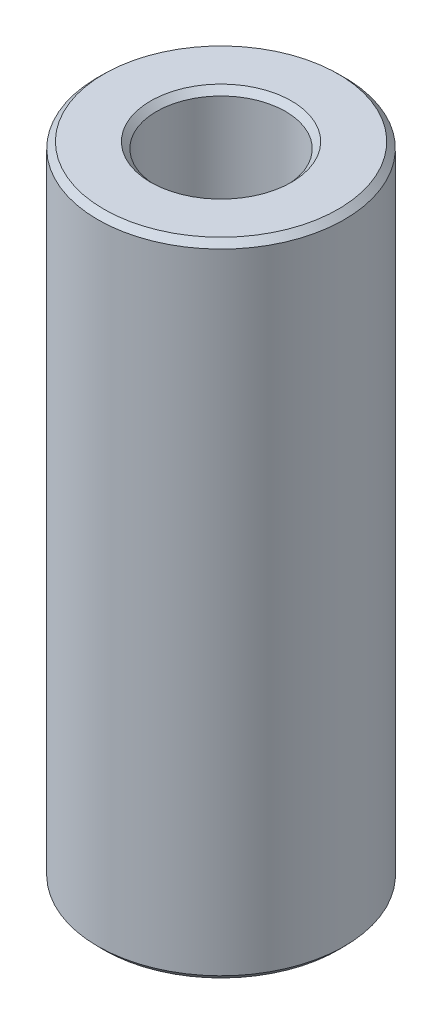
from build123d import *
from OCP.BRepFilletAPI import BRepFilletAPI_MakeChamfer

# Parameters (mm, degrees)
SKETCH1_R           = 10
BOSS_EXTRUDE1_DEPTH = 52.029353738
SKETCH2_R           = 5.234280895
CUT_EXTRUDE1_DEPTH  = 54.917099796
CHAMFER1_SIZE       = 0.483309275
CHAMFER1_SIZE2      = 0.496036834


with BuildPart() as part:
    # Sketch1 → Boss-Extrude1 (new body)
    with BuildSketch(Plane(origin=(0, 0, 0), x_dir=(1, 0, 0), z_dir=(0, 1, 0))):
        Circle(SKETCH1_R)
    extrude(amount=BOSS_EXTRUDE1_DEPTH)

    # Sketch2 → Cut-Extrude1 (cut, through all)
    with BuildSketch(Plane(origin=(0, 0, 0), x_dir=(1, 0, 0), z_dir=(0, 1, 0))):
        Circle(SKETCH2_R)
    extrude(amount=CUT_EXTRUDE1_DEPTH, mode=Mode.SUBTRACT)

    # Chamfer1: one chamfer whose edges measure the first distance from different faces: ONE call of the kernel's chamfer builder (chamfer() names one face for all edges)
    chamfer1_edges_1 = [part.edges().sort_by_distance(p)[0] for p in [
        (-5.234280895, 52.029353738, 0),
    ]]
    chamfer1_side_1 = [part.faces().sort_by_distance(p)[0] for p in [
        (-9.717157288, 52.029353738, 0),
    ]]
    chamfer1_edges_2 = [part.edges().sort_by_distance(p)[0] for p in [
        (-5.234280895, 0, 0),
    ]]
    chamfer1_side_2 = [part.faces().sort_by_distance(p)[0] for p in [
        (-5.234280895, 26.014676869, 0),
    ]]
    chamfer1_edges_3 = [part.edges().sort_by_distance(p)[0] for p in [
        (-10, 0, 0),
    ]]
    chamfer1_side_3 = [part.faces().sort_by_distance(p)[0] for p in [
        (-9.717157288, 0, 0),
    ]]
    chamfer1_edges_4 = [part.edges().sort_by_distance(p)[0] for p in [
        (-10, 52.029353738, 0),
    ]]
    chamfer1_side_4 = [part.faces().sort_by_distance(p)[0] for p in [
        (-10, 26.014676869, 0),
    ]]
    chamfer1 = BRepFilletAPI_MakeChamfer(part.part.solid().wrapped)
    for e in chamfer1_edges_1:
        chamfer1.Add(CHAMFER1_SIZE, CHAMFER1_SIZE2, e.wrapped, chamfer1_side_1[0].wrapped)  # the first distance lies on this face
    for e in chamfer1_edges_2:
        chamfer1.Add(CHAMFER1_SIZE, CHAMFER1_SIZE2, e.wrapped, chamfer1_side_2[0].wrapped)  # the first distance lies on this face
    for e in chamfer1_edges_3:
        chamfer1.Add(CHAMFER1_SIZE, CHAMFER1_SIZE2, e.wrapped, chamfer1_side_3[0].wrapped)  # the first distance lies on this face
    for e in chamfer1_edges_4:
        chamfer1.Add(CHAMFER1_SIZE, CHAMFER1_SIZE2, e.wrapped, chamfer1_side_4[0].wrapped)  # the first distance lies on this face
    add(Compound.cast(chamfer1.Shape()), mode=Mode.REPLACE)


solid = part.part
